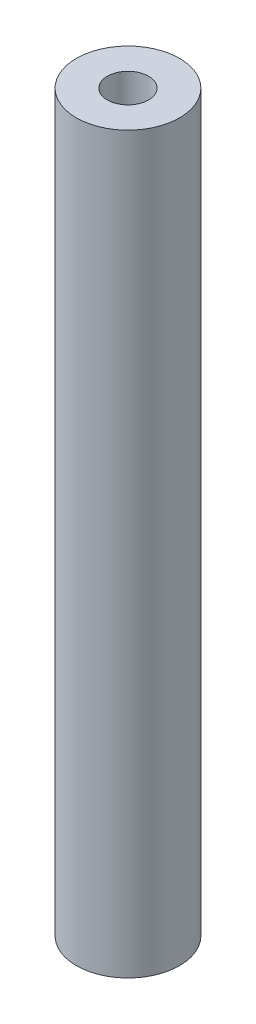
from build123d import *

# Parameters (mm, degrees)
SKETCH_1_R          = 6.25
EXTRUDE_1_DEPTH     = 89
SKETCH_2_R          = 2.5
CUT_EXTRUDE_1_DEPTH = 10
CUT_EXTRUDE_START   = -10
SKETCH_17_R         = 2.5
CUT_EXTRUDE_2_DEPTH = 10


with BuildPart() as part:
    # 草图1 → 凸台-拉伸1 (new body)
    with BuildSketch(Plane(origin=(0, 0, 0), x_dir=(1, 0, 0), z_dir=(0, 1, 0))):
        Circle(SKETCH_1_R)
    extrude(amount=EXTRUDE_1_DEPTH)

    # 草图2 → 切除-拉伸1 (cut)
    with BuildSketch(Plane(origin=(0, 89, 0), x_dir=(1, 0, 0), z_dir=(0, 1, 0))):
        Circle(SKETCH_2_R)
    extrude(amount=-CUT_EXTRUDE_1_DEPTH, mode=Mode.SUBTRACT)

    # 草图17 → 切除-拉伸2 (cut)
    with BuildSketch(Plane.XZ.offset(CUT_EXTRUDE_START)):
        Circle(SKETCH_17_R)
    extrude(amount=CUT_EXTRUDE_2_DEPTH, mode=Mode.SUBTRACT)


solid = part.part
